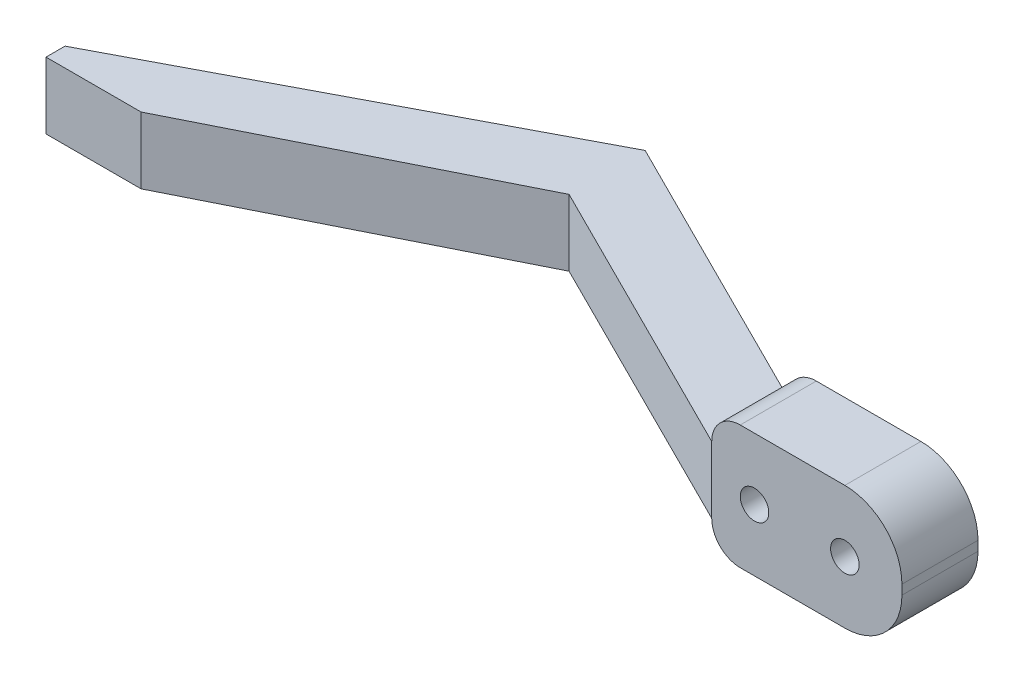
from build123d import *

# Parameters (mm, degrees)
BOSS_EXTRUDE1_DEPTH      = 7
BOSS_EXTRUDE2_DEPTH      = 3
BOSS_EXTRUDE2_DEPTH_BACK = 10
SKETCH2_W                = 20
SKETCH2_H                = 8
FILLET1_R                = 6
FILLET2_R                = 3
F_3_0_3_DIAMETER_HOLE1_D = 3


with BuildPart() as part:
    # Sketch1 → Boss-Extrude1 (new body)
    with BuildSketch(Plane(origin=(0, 0, 0), x_dir=(1, 0, 0), z_dir=(0, 1, 0))):
        Polygon((50, 0), (50, 8), (30, 8), (0, 23), (-40, 2), (-40, 0), (-30, 0), (0, 15), (30, 0), align=None)
    extrude(amount=BOSS_EXTRUDE1_DEPTH)

    # Sketch2 → Boss-Extrude2 (add, two sides: drawn at the far end of the back side and taken through both)
    with BuildSketch(Plane(origin=(0, 7, 0), x_dir=(1, 0, 0), z_dir=(0, 1, 0)).offset(-BOSS_EXTRUDE2_DEPTH_BACK)):
        with Locations((40, 4)):
            Rectangle(SKETCH2_W, SKETCH2_H)
    extrude(amount=BOSS_EXTRUDE2_DEPTH + BOSS_EXTRUDE2_DEPTH_BACK)

    # Fillet1
    fillet1_edges = [part.edges().sort_by_distance(p)[0] for p in [
        (50, -3, -4),
        (50, 10, -4),
    ]]
    fillet(fillet1_edges, radius=FILLET1_R)

    # Fillet2
    fillet2_edges = [part.edges().sort_by_distance(p)[0] for p in [
        (30, -3, -4),
        (30, 10, -4),
    ]]
    fillet(fillet2_edges, radius=FILLET2_R - 0.0001)  # a hair under: the kernel refuses the full size

    # Ø3.0 (3) Diameter Hole1 (through all)
    with Locations(Plane(origin=(0, 0, -8), x_dir=(-1, 0, 0), z_dir=(0, 0, -1))):
        with Locations((-44, 3.5), (-34.5, 3.5)):
            Hole(F_3_0_3_DIAMETER_HOLE1_D / 2)


solid = part.part
